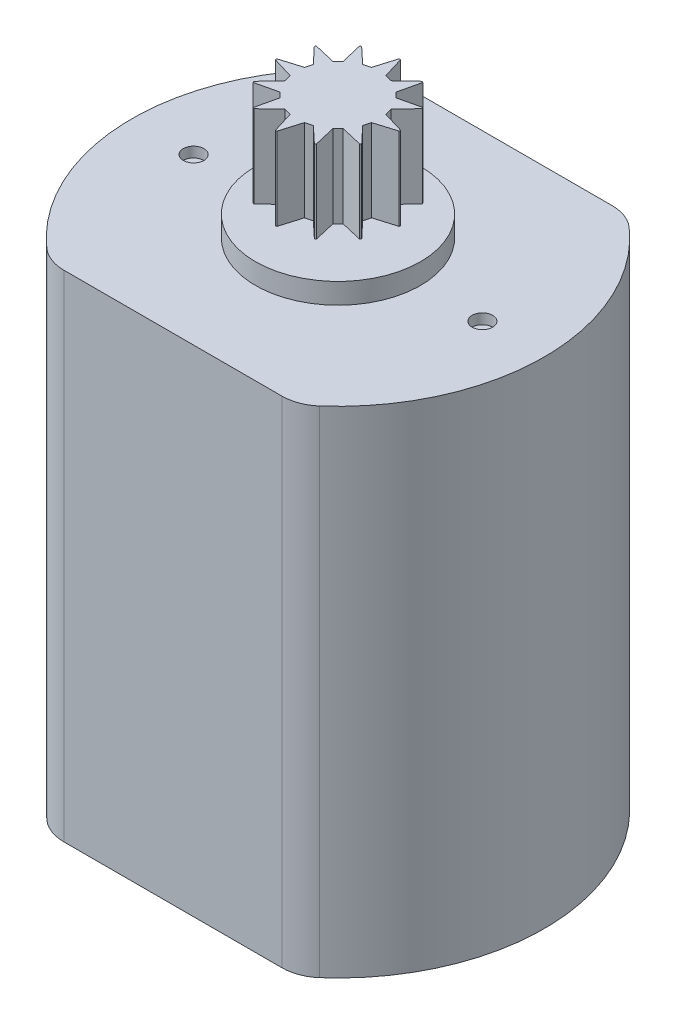
from build123d import *

# Parameters (mm, degrees)
BOSS_EXTRUDE1_DEPTH = 12
SKETCH3_R           = 2
BOSS_EXTRUDE2_DEPTH = 1
FILLET3_R           = 1
BOSS_EXTRUDE3_START = 0.5
SKETCH4_R           = 2
BOSS_EXTRUDE3_DEPTH = 0.5
SKETCH5_R           = 0.25
CUT_EXTRUDE1_DEPTH  = 0.25
SKETCH6_R           = 0.25
BOSS_EXTRUDE4_DEPTH = 2.5
SKETCH7_R           = 1.5
BOSS_EXTRUDE5_DEPTH = 2
CUT_EXTRUDE11_DEPTH = 2
CIRPATTERN2_COUNT   = 12


with BuildPart() as part:
    # Sketch2 → Boss-Extrude1 (new body)
    with BuildSketch(Plane(origin=(0, 0, 0), x_dir=(1, 0, 0), z_dir=(0, 1, 0))):
        with BuildLine():
            Line((-3, 4), (3, 4))
            ThreePointArc((3, 4), (5, 0), (3, -4))
            Line((3, -4), (-3, -4))
            ThreePointArc((-3, -4), (-5, 0), (-3, 4))
        make_face()
    extrude(amount=BOSS_EXTRUDE1_DEPTH)

    # Sketch3 → Boss-Extrude2 (add)
    with BuildSketch(Plane(origin=(0, 0, 0), x_dir=(-1, 0, 0), z_dir=(0, -1, 0))):
        Circle(SKETCH3_R)
    extrude(amount=BOSS_EXTRUDE2_DEPTH)

    # Fillet3
    fillet3_edges = [part.edges().sort_by_distance(p)[0] for p in [
        (-3, 6, 4),
        (3, 6, 4),
        (-3, 6, -4),
        (3, 6, -4),
    ]]
    fillet(fillet3_edges, radius=FILLET3_R)

    # Sketch4 → Boss-Extrude3 (add)
    with BuildSketch(Plane(origin=(0, 12, 0), x_dir=(1, 0, 0), z_dir=(0, 1, 0)).offset(BOSS_EXTRUDE3_START)):
        Circle(SKETCH4_R)
    extrude(amount=-BOSS_EXTRUDE3_DEPTH)

    # Sketch5 → Cut-Extrude1 (cut)
    with BuildSketch(Plane(origin=(0, 12, 0), x_dir=(1, 0, 0), z_dir=(0, 1, 0))):
        with Locations((3.5, 0)):
            Circle(SKETCH5_R)
    cut_extrude1 = extrude(amount=-CUT_EXTRUDE1_DEPTH, mode=Mode.SUBTRACT)

    # Mirror1: Cut-Extrude1 across plane
    add(cut_extrude1.mirror(Plane(origin=(0, 0, 0), x_dir=(0, 0, 1), z_dir=(1, 0, 0))), mode=Mode.SUBTRACT)

    # Sketch6 → Boss-Extrude4 (add)
    with BuildSketch(Plane(origin=(0, 12.5, 0), x_dir=(1, 0, 0), z_dir=(0, 1, 0))):
        Circle(SKETCH6_R)
    extrude(amount=BOSS_EXTRUDE4_DEPTH)

    # Sketch7 → Boss-Extrude5 (add)
    with BuildSketch(Plane(origin=(0, 15, 0), x_dir=(1, 0, 0), z_dir=(0, 1, 0))):
        Circle(SKETCH7_R)
    extrude(amount=-BOSS_EXTRUDE5_DEPTH)

    # Sketch9 → Cut-Extrude11 (cut)
    with BuildSketch(Plane(origin=(0, 15, 0), x_dir=(1, 0, 0), z_dir=(0, 1, 0))):
        Polygon((-0.342020143, -0.939692621), (-0.173648178, -0.984807753), (0, -1.556082509), (-0.781544676, -1.353675088), align=None)
    cut_extrude11 = extrude(amount=-CUT_EXTRUDE11_DEPTH, mode=Mode.SUBTRACT)

    # CirPattern2: Cut-Extrude11 ×12 about axis
    cirpattern2_axis = Axis((0, 0, 0), (0, 1, 0))
    for i in range(1, CIRPATTERN2_COUNT):
        add(cut_extrude11.rotate(cirpattern2_axis, i * 360 / CIRPATTERN2_COUNT), mode=Mode.SUBTRACT)


solid = part.part
